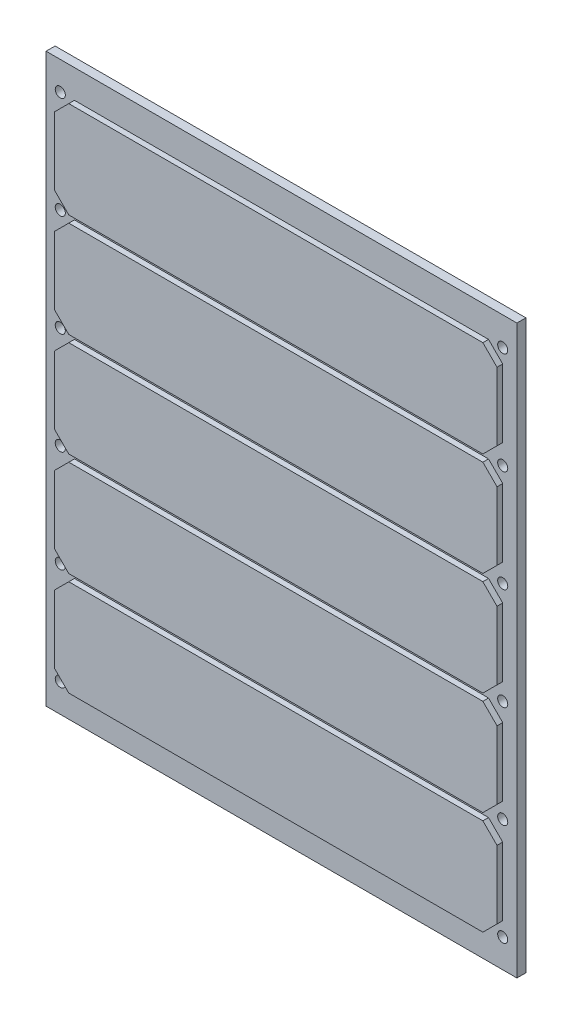
from build123d import *

# Parameters (mm, degrees)
SKETCH1_W                 = 83
SKETCH1_H                 = 100
BOSS_EXTRUDE1_DEPTH       = 1.5875
BOSS_EXTRUDE2_DEPTH       = 1
F_0_CLEARANCE_HOLE1_D     = 1.778
F_0_CLEARANCE_HOLE1_DEPTH = 3.175
F_0_CLEARANCE_HOLE1_TIP   = 0.53416509


with BuildPart() as part:
    # Sketch1 → Boss-Extrude1 (new body)
    with BuildSketch(Plane.XY):
        Rectangle(SKETCH1_W, SKETCH1_H)
    extrude(amount=BOSS_EXTRUDE1_DEPTH)

    # Sketch2 → Boss-Extrude2 (add)
    with BuildSketch(Plane.XY.offset(1.5875)):
        Polygon((-36.5, 45), (36.5, 45), (39, 42.5), (39, 30.5), (36.5, 28), (-36.5, 28), (-39, 30.5), (-39, 42.5), align=None)
        Polygon((-36.5, 26.75), (36.5, 26.75), (39, 24.25), (39, 12.25), (36.5, 9.75), (-36.5, 9.75), (-39, 12.25), (-39, 24.25), align=None)
        Polygon((-36.5, 8.5), (36.5, 8.5), (39, 6), (39, -6), (36.5, -8.5), (-36.5, -8.5), (-39, -6), (-39, 6), align=None)
        Polygon((-36.5, -9.75), (36.5, -9.75), (39, -12.25), (39, -24.25), (36.5, -26.75), (-36.5, -26.75), (-39, -24.25), (-39, -12.25), align=None)
        Polygon((-36.5, -28), (36.5, -28), (39, -30.5), (39, -42.5), (36.5, -45), (-36.5, -45), (-39, -42.5), (-39, -30.5), align=None)
    extrude(amount=BOSS_EXTRUDE2_DEPTH)

    # #0 Clearance Hole1
    with Locations(Plane.XY.offset(1.5875)):
        with Locations((-39, 45), (-39, 27), (-39, 9), (-39, -9), (-39, -27), (-39, -45), (39, -45), (39, -27), (39, -9), (39, 9), (39, 27), (39, 45)):
            Hole(F_0_CLEARANCE_HOLE1_D / 2, depth=F_0_CLEARANCE_HOLE1_DEPTH)
            with Locations((0, 0, -(F_0_CLEARANCE_HOLE1_DEPTH + F_0_CLEARANCE_HOLE1_TIP / 2))):  # 118° drill point
                Cone(0, F_0_CLEARANCE_HOLE1_D / 2, F_0_CLEARANCE_HOLE1_TIP, mode=Mode.SUBTRACT)


solid = part.part
